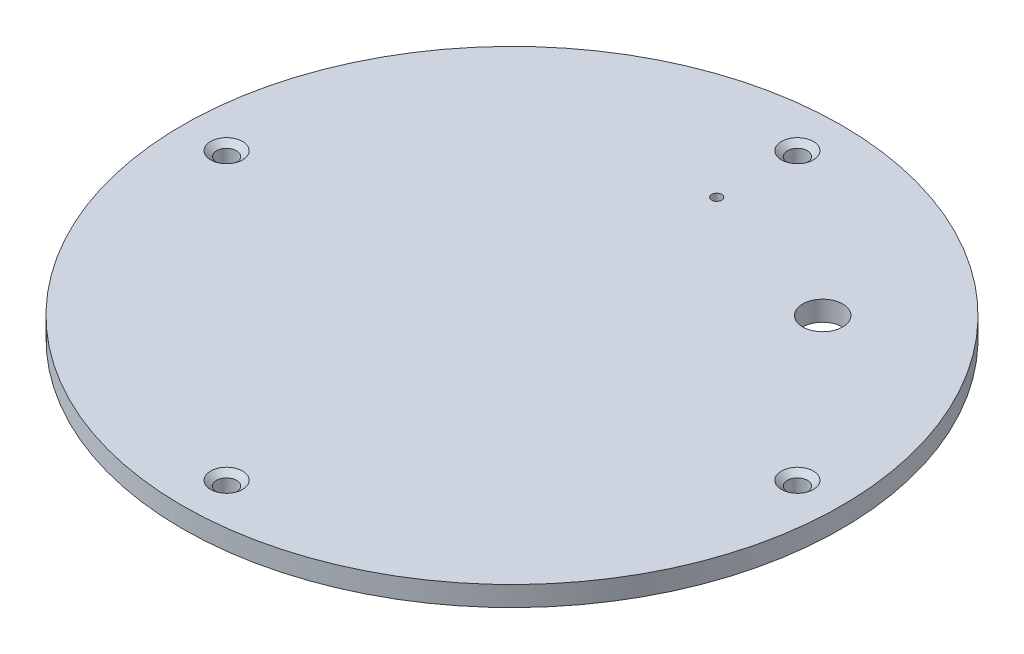
from build123d import *

# Parameters (mm, degrees)
SKETCH1_R                                       = 16.5
BOSS_EXTRUDE1_DEPTH                             = 1
CUT_EXTRUDE1_DEPTH                              = 24.355941428
CUT_EXTRUDE1_DEPTH_BACK                         = 24.355941428
SKETCH6_R                                       = 0.25
SKETCH6_R_2                                     = 1
CSK_FOR_M2_FLAT_HEAD_MACHINE_SCREW1_D           = 1
CSK_FOR_M2_FLAT_HEAD_MACHINE_SCREW1_CSINK_D     = 1.6
CSK_FOR_M2_FLAT_HEAD_MACHINE_SCREW1_CSINK_ANGLE = 100


with BuildPart() as part:
    # Sketch1 → Boss-Extrude1 (new body)
    with BuildSketch(Plane(origin=(0, 0, 0), x_dir=(1, 0, 0), z_dir=(0, 1, 0))):
        Circle(SKETCH1_R)
    extrude(amount=BOSS_EXTRUDE1_DEPTH)

    # Sketch6 → Cut-Extrude1 (cut, two sides: drawn at the far end of the back side and taken through both)
    with BuildSketch(Plane(origin=(0, 1, 0), x_dir=(1, 0, 0), z_dir=(0, 1, 0)).offset(-CUT_EXTRUDE1_DEPTH_BACK)):
        with Locations((0, 10.25)):
            Circle(SKETCH6_R)
        with Locations((7.778174593, 7.778174593)):
            Circle(SKETCH6_R_2)
    extrude(amount=CUT_EXTRUDE1_DEPTH + CUT_EXTRUDE1_DEPTH_BACK, mode=Mode.SUBTRACT)

    # CSK for M2 Flat Head Machine Screw1 (through all)
    with Locations(Plane(origin=(0, 1, 0), x_dir=(1, 0, 0), z_dir=(0, 1, 0))):
        with Locations((0, 14.29), (-14.29, 0), (0, -14.29), (14.29, 0)):
            CounterSinkHole(CSK_FOR_M2_FLAT_HEAD_MACHINE_SCREW1_D / 2, CSK_FOR_M2_FLAT_HEAD_MACHINE_SCREW1_CSINK_D / 2, counter_sink_angle=CSK_FOR_M2_FLAT_HEAD_MACHINE_SCREW1_CSINK_ANGLE)


solid = part.part
